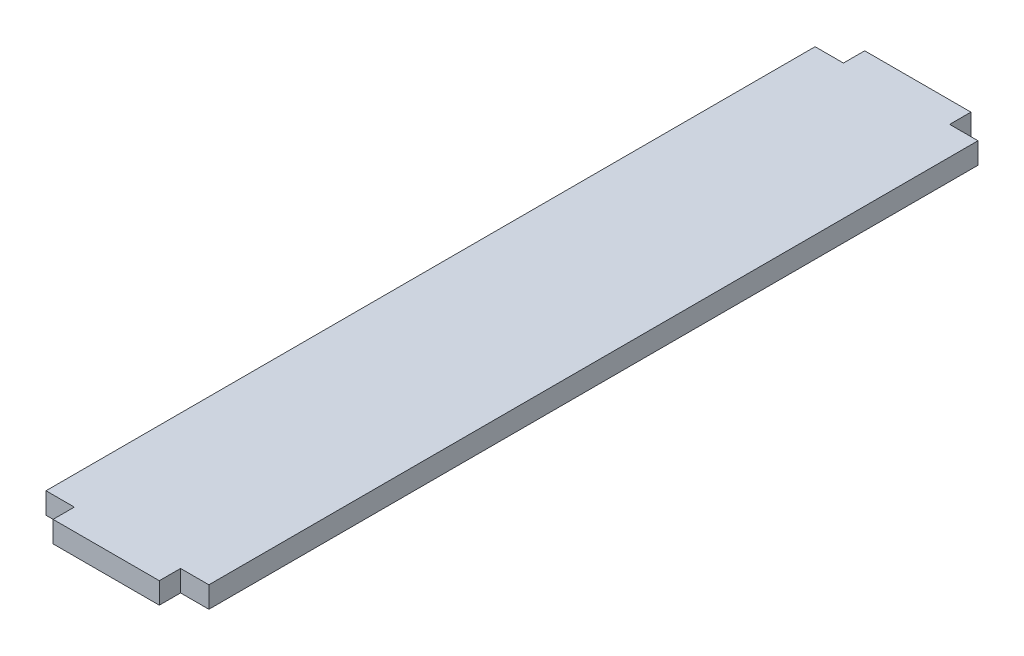
from build123d import *

# Parameters (mm, degrees)
BOSS_EXTRUDE1_DEPTH = 1.5


with BuildPart() as part:
    # Sketch1 → Boss-Extrude1 (new body)
    with BuildSketch(Plane(origin=(0, 0, 0), x_dir=(1, 0, 0), z_dir=(0, 1, 0))):
        Polygon((3.75, 27.15), (5.75, 27.15), (5.75, -12.75), (5.75, -14.45), (5.75, -27.15), (3.75, -27.15), (3.75, -28.65), (-3.75, -28.65), (-3.75, -27.15), (-5.75, -27.15), (-5.75, -19.45), (-5.75, -17.75), (-5.75, 27.15), (-3.75, 27.15), (-3.75, 28.65), (3.75, 28.65), align=None)
    extrude(amount=BOSS_EXTRUDE1_DEPTH)


solid = part.part
